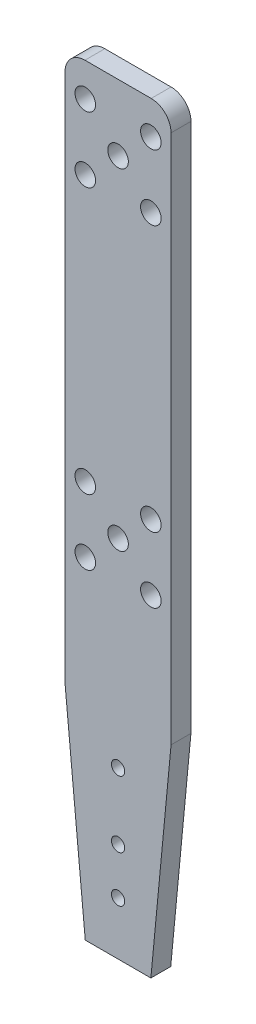
from build123d import *

# Parameters (mm, degrees)
SKETCH_1_R          = 1.55
EXTRUDE_1_DEPTH     = 3
SKETCH_2_W          = 30.67898901
SKETCH_2_H          = 20.291672983
CUT_EXTRUDE_1_DEPTH = 10
SKETCH_3_R          = 1
CUT_EXTRUDE_2_DEPTH = 20


with BuildPart() as part:
    # 草图1 → 凸台-拉伸1 (new body)
    with BuildSketch(Plane.XY):
        with BuildLine():
            Line((5, 16.216737463), (-5, 16.216737463))
            ThreePointArc((-5, 16.216737463), (-7.121320344, 15.338057806), (-8, 13.216737463))
            Line((-8, 13.216737463), (-8, -66.783262537))
            Line((-8, -66.783262537), (-4, -108.783262537))
            Line((-4, -108.783262537), (4, -108.783262537))
            Line((4, -108.783262537), (8, -66.783262537))
            Line((8, -66.783262537), (8, 13.216737463))
            ThreePointArc((8, 13.216737463), (7.121320344, 15.338057806), (5, 16.216737463))
        make_face()
        with Locations((-4.949747468, 11.166484931)):
            Circle(SKETCH_1_R, mode=Mode.SUBTRACT)
        with Locations((4.949747468, 11.166484931)):
            Circle(SKETCH_1_R, mode=Mode.SUBTRACT)
        with Locations((4.949747468, 1.266989995)):
            Circle(SKETCH_1_R, mode=Mode.SUBTRACT)
        with Locations((-4.949747468, 1.266989995)):
            Circle(SKETCH_1_R, mode=Mode.SUBTRACT)
        with Locations((0, -43.783262537)):
            Circle(SKETCH_1_R, mode=Mode.SUBTRACT)
        with Locations((4.949747468, -38.833515069)):
            Circle(SKETCH_1_R, mode=Mode.SUBTRACT)
        with Locations((-4.949747468, -38.833515069)):
            Circle(SKETCH_1_R, mode=Mode.SUBTRACT)
        with Locations((4.949747468, -48.733010005)):
            Circle(SKETCH_1_R, mode=Mode.SUBTRACT)
        with Locations((-4.949747468, -48.733010005)):
            Circle(SKETCH_1_R, mode=Mode.SUBTRACT)
        with Locations((0, 6.216737463)):
            Circle(SKETCH_1_R, mode=Mode.SUBTRACT)
    extrude(amount=EXTRUDE_1_DEPTH)

    # 草图2 → 切除-拉伸1 (cut)
    with BuildSketch(Plane(origin=(0, 0, 0), x_dir=(-1, 0, 0), z_dir=(0, 0, -1))):
        with Locations((1.230440634, -108.929099029)):
            Rectangle(SKETCH_2_W, SKETCH_2_H)
    extrude(amount=-CUT_EXTRUDE_1_DEPTH, mode=Mode.SUBTRACT)

    # 草图3 → 切除-拉伸2 (cut)
    with BuildSketch(Plane(origin=(0, 0, 0), x_dir=(-1, 0, 0), z_dir=(0, 0, -1))):
        with Locations((0, -83.783262537)):
            Circle(SKETCH_3_R)
        with Locations((0, -90.783262537)):
            Circle(SKETCH_3_R)
        with Locations((0, -73.783262537)):
            Circle(SKETCH_3_R)
    extrude(amount=-CUT_EXTRUDE_2_DEPTH, mode=Mode.SUBTRACT)


solid = part.part
